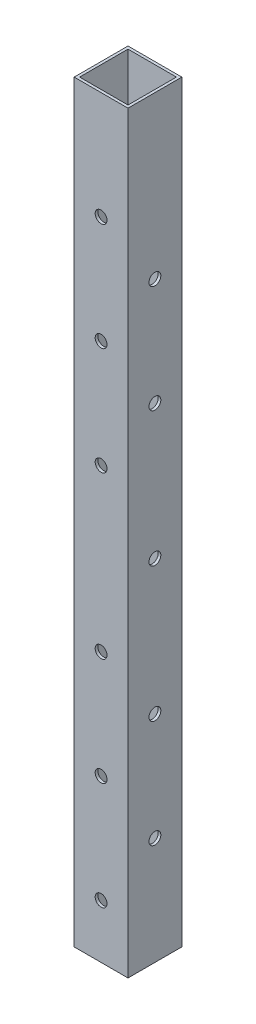
from build123d import *

# Parameters (mm, degrees)
EXTRUDE_1_DEPTH     = 280
SKETCH_2_R          = 2.2
CUT_EXTRUDE_1_DEPTH = 280
SKETCH_3_R          = 2.2
CUT_EXTRUDE_2_DEPTH = 20


with BuildPart() as part:
    # 草图1 → 凸台-拉伸1 (new body)
    with BuildSketch(Plane(origin=(0, 0, 0), x_dir=(1, 0, 0), z_dir=(0, 1, 0))):
        Polygon((10, 0), (10, 10), (0, 10), (-10, 10), (-10, 0), (-10, -10), (0, -10), (10, -10), align=None)
        Polygon((9, 0), (9, 9), (0, 9), (-9, 9), (-9, 0), (-9, -9), (0, -9), (9, -9), align=None, mode=Mode.SUBTRACT)
    extrude(amount=-EXTRUDE_1_DEPTH)

    # 草图2 → 切除-拉伸1 (cut)
    with BuildSketch(Plane.XY.offset(10)):
        with Locations((0, -40)):
            Circle(SKETCH_2_R)
        with Locations((0, -80)):
            Circle(SKETCH_2_R)
        with Locations((0, -120)):
            Circle(SKETCH_2_R)
        with Locations((0, -180)):
            Circle(SKETCH_2_R)
        with Locations((0, -220)):
            Circle(SKETCH_2_R)
        with Locations((0, -260)):
            Circle(SKETCH_2_R)
    extrude(amount=-CUT_EXTRUDE_1_DEPTH, mode=Mode.SUBTRACT)

    # 草图3 → 切除-拉伸2 (cut)
    with BuildSketch(Plane(origin=(10, 0, 0), x_dir=(0, 0, -1), z_dir=(1, 0, 0))):
        with Locations((0, -60)):
            Circle(SKETCH_3_R)
        with Locations((0, -100)):
            Circle(SKETCH_3_R)
        with Locations((0, -150)):
            Circle(SKETCH_3_R)
        with Locations((0, -200)):
            Circle(SKETCH_3_R)
        with Locations((0, -240)):
            Circle(SKETCH_3_R)
    extrude(amount=-CUT_EXTRUDE_2_DEPTH, mode=Mode.SUBTRACT)


solid = part.part
